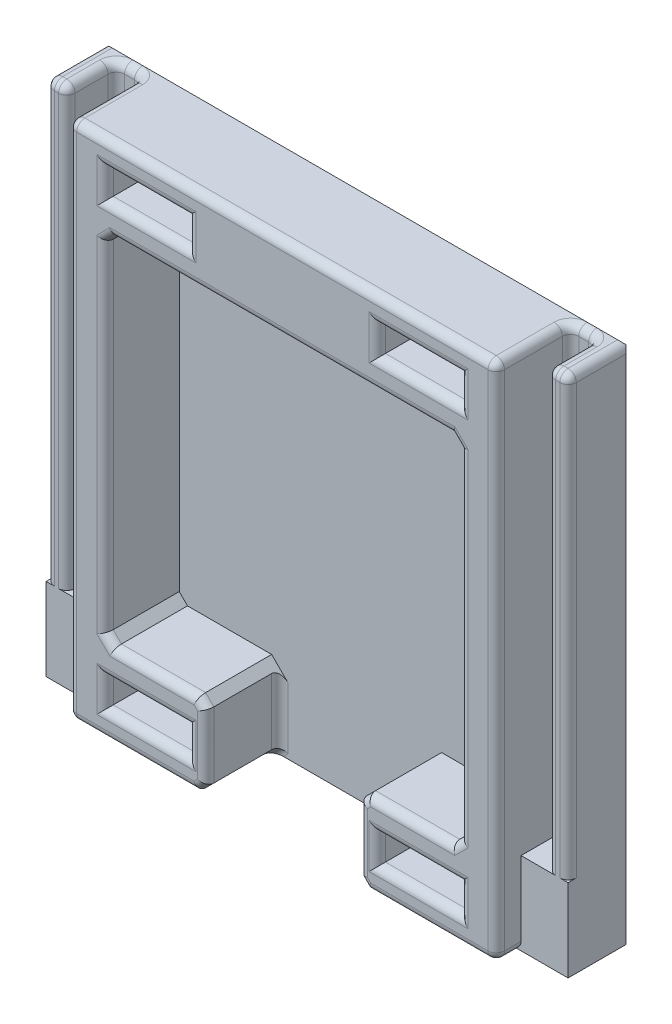
from build123d import *

# Parameters (mm, degrees)
BOSS_EXTRU_2_DEPTH      = 9
ESQUISSE3_W             = 51.8612703
ESQUISSE3_H             = 63
BOSS_EXTRU_3_DEPTH      = 3
ESQUISSE4_W             = 10
ESQUISSE4_H             = 3.4
ENL_V_MAT_EXTRU_1_DEPTH = 7
ESQUISSE5_W             = 3.2
ESQUISSE5_H             = 3
BOSS_EXTRU_4_DEPTH      = 63
CHANFREIN1_SIZE         = 1
CHANFREIN2_SIZE         = 2
CONG_1_R                = 1
CONG_2_R                = 1
CHANFREIN4_SIZE         = 1
CONG_4_R                = 1
CONG_5_R                = 1
ESQUISSE6_W             = 6.7
ESQUISSE6_H             = 1
BOSS_EXTRU_5_DEPTH      = 10


with BuildPart() as part:
    # Esquisse2 → Boss.-Extru.2 (new body)
    with BuildSketch(Plane.XY):
        Polygon((-9.3, -31.5), (-9.3, -21.5), (-21.5, -21.5), (-21.5, 21.5), (21.5, 21.5), (21.5, -21.5), (9.3, -21.5), (9.3, -31.5), (25.93063515, -31.5), (25.93063515, 31.5), (-25.93063515, 31.5), (-25.93063515, -31.5), align=None)
    extrude(amount=BOSS_EXTRU_2_DEPTH)

    # Esquisse3 → Boss.-Extru.3 (add)
    with BuildSketch(Plane(origin=(0, 0, 0), x_dir=(-1, 0, 0), z_dir=(0, 0, -1))):
        Rectangle(ESQUISSE3_W, ESQUISSE3_H)
    extrude(amount=BOSS_EXTRU_3_DEPTH)

    # Esquisse4 → Enlèv. mat.-Extru.1 (cut)
    with BuildSketch(Plane.XY.offset(9)):
        with Locations((-16.5, -26.695538472)):
            Rectangle(ESQUISSE4_W, ESQUISSE4_H)
        with Locations((16.5, -26.695538472)):
            Rectangle(ESQUISSE4_W, ESQUISSE4_H)
        with Locations((16.5, 26.695538472)):
            Rectangle(ESQUISSE4_W, ESQUISSE4_H)
        with Locations((-16.5, 26.695538472)):
            Rectangle(ESQUISSE4_W, ESQUISSE4_H)
    extrude(amount=-ENL_V_MAT_EXTRU_1_DEPTH, mode=Mode.SUBTRACT)

    # Esquisse5 → Boss.-Extru.4 (add)
    with BuildSketch(Plane(origin=(0, 31.5, 0), x_dir=(1, 0, 0), z_dir=(0, 1, 0))):
        Polygon((-29.13063515, 0), (-29.13063515, 3), (-31.63063515, 3), (-31.63063515, -6), (-29.13063515, -6), align=None)
        with Locations((-27.53063515, 1.5)):
            Rectangle(ESQUISSE5_W, ESQUISSE5_H)
        with Locations((27.53063515, 1.5)):
            Rectangle(ESQUISSE5_W, ESQUISSE5_H)
        Polygon((29.13063515, 3), (29.13063515, 0), (29.13063515, -6), (31.63063515, -6), (31.63063515, 3), align=None)
    extrude(amount=-BOSS_EXTRU_4_DEPTH)

    # Chanfrein1
    chanfrein1_edges = [part.edges().sort_by_distance(p)[0] for p in [
        (21.5, -21.5, 4.5),
        (21.5, 21.5, 4.5),
        (-21.5, 21.5, 4.5),
        (-21.5, -21.5, 4.5),
    ]]
    chamfer(chanfrein1_edges, length=CHANFREIN1_SIZE)

    # Chanfrein2
    chanfrein2_edges = [part.edges().sort_by_distance(p)[0] for p in [
        (-31.63063515, 0, -3),
        (31.63063515, 0, -3),
        (0, -31.5, -3),
        (0, 31.5, -3),
    ]]
    chamfer(chanfrein2_edges, length=CHANFREIN2_SIZE)

    # Congé1
    cong_1_edges = [part.edges().sort_by_distance(p)[0] for p in [
        (-25.93063515, 0, 0),
        (-29.13063515, 0, 0),
        (-29.13063515, 0, 6),
        (-31.63063515, 0, 6),
        (25.93063515, 0, 0),
        (29.13063515, 0, 0),
        (29.13063515, 0, 6),
        (31.63063515, 0, 6),
    ]]
    fillet(cong_1_edges, radius=CONG_1_R)

    # Congé2
    cong_2_edges = [part.edges().sort_by_distance(p)[0] for p in [
        (-31.63063515, 31.5, 2),
        (31.63063515, 31.5, 2),
        (30.38063515, -31.5, 6),
        (30.38063515, 31.5, 6),
        (-30.38063515, 31.5, 6),
        (-29.13063515, 31.5, 3),
        (-27.53063515, 31.5, 0),
        (27.53063515, 31.5, 0),
        (29.13063515, 31.5, 3),
        (-31.337741931, 31.5, 5.707106781),
        (-29.423528369, 31.5, 5.707106781),
        (29.423528369, 31.5, 5.707106781),
        (31.337741931, 31.5, 5.707106781),
        (31.63063515, -31.5, 2),
        (-31.63063515, -31.5, 2),
        (29.13063515, -31.5, 3),
        (27.53063515, -31.5, 0),
        (-27.53063515, -31.5, 0),
        (-29.13063515, -31.5, 3),
        (-30.38063515, -31.5, 6),
        (-31.337741931, -31.5, 5.707106781),
        (-29.423528369, -31.5, 5.707106781),
        (29.423528369, -31.5, 5.707106781),
        (31.337741931, -31.5, 5.707106781),
        (28.837741931, 31.5, 0.292893219),
        (28.837741931, -31.5, 0.292893219),
        (26.223528369, 31.5, 0.292893219),
        (26.223528369, -31.5, 0.292893219),
        (-28.837741931, 31.5, 0.292893219),
        (-28.837741931, -31.5, 0.292893219),
        (-26.223528369, 31.5, 0.292893219),
        (-26.223528369, -31.5, 0.292893219),
        (-25.93063515, -31.5, 5),
        (-25.93063515, 31.5, 5),
        (25.93063515, 31.5, 5),
        (25.93063515, -31.5, 5),
    ]]
    fillet(cong_2_edges, radius=CONG_2_R - 0.0001)  # a hair under: the kernel refuses the full size

    # Chanfrein4
    chanfrein4_edges = [part.edges().sort_by_distance(p)[0] for p in [
        (-9.3, -31.5, 4.5),
        (9.3, -31.5, 4.5),
        (9.3, -21.5, 4.5),
        (-9.3, -21.5, 4.5),
    ]]
    chamfer(chanfrein4_edges, length=CHANFREIN4_SIZE)

    # Congé4
    cong_4_edges = [part.edges().sort_by_distance(p)[0] for p in [
        (-21.5, 0, 9),
        (-15.4, -21.5, 9),
        (21.5, 0, 9),
        (0, 21.5, 9),
        (-21, -21, 9),
        (21, -21, 9),
        (21, 21, 9),
        (-21, 21, 9),
        (0, 31.5, 9),
        (-17.615367575, -31.5, 9),
        (-25.93063515, 0, 9),
        (25.93063515, 0, 9),
        (25.63777122, 31.207136071, 9),
        (25.63777122, -31.207136071, 9),
        (-25.63777122, -31.207136071, 9),
        (-25.63777122, 31.207136071, 9),
        (17.615367575, -31.5, 9),
        (9.3, -26.5, 9),
        (-9.3, -26.5, 9),
        (15.4, -21.5, 9),
        (-9.8, -22, 9),
        (9.8, -22, 9),
        (-9.8, -31, 9),
        (9.8, -31, 9),
        (-16.5, 28.395538472, 9),
        (-11.5, 26.695538472, 9),
        (-21.5, 26.695538472, 9),
        (-16.5, 24.995538472, 9),
        (21.5, 26.695538472, 9),
        (16.5, 24.995538472, 9),
        (16.5, 28.395538472, 9),
        (11.5, 26.695538472, 9),
        (16.5, -28.395538472, 9),
        (11.5, -26.695538472, 9),
        (21.5, -26.695538472, 9),
        (16.5, -24.995538472, 9),
        (-21.5, -26.695538472, 9),
        (-16.5, -24.995538472, 9),
        (-16.5, -28.395538472, 9),
        (-11.5, -26.695538472, 9),
    ]]
    fillet(cong_4_edges, radius=CONG_4_R - 0.0001)  # a hair under: the kernel refuses the full size

    # Congé5
    cong_5_edges = [part.edges().sort_by_distance(p)[0] for p in [
        (9.3, -26.5, 0),
        (-9.3, -26.5, 0),
        (9.8, -31, 0),
        (-9.8, -31, 0),
    ]]
    fillet(cong_5_edges, radius=CONG_5_R)

    # Esquisse6 → Boss.-Extru.5 (add)
    with BuildSketch(Plane.XZ.offset(31.5)):
        with BuildLine():
            Line((-24.93063515, 1), (-24.93063515, 5))
            Line((-24.93063515, 5), (-31.63063515, 5))
            Line((-31.63063515, 5), (-31.63063515, -1))
            Line((-31.63063515, -1), (-26.93063515, -1))
            ThreePointArc((-26.93063515, -1), (-25.516421587, -0.414213562), (-24.93063515, 1))
        make_face()
        with Locations((-28.28063515, 5.5)):
            Rectangle(ESQUISSE6_W, ESQUISSE6_H)
        with BuildLine():
            Line((31.63063515, -1), (31.63063515, 5))
            Line((31.63063515, 5), (24.93063515, 5))
            Line((24.93063515, 5), (24.93063515, 1))
            ThreePointArc((24.93063515, 1), (25.516421587, -0.414213562), (26.93063515, -1))
            Line((26.93063515, -1), (31.63063515, -1))
        make_face()
        with Locations((28.28063515, 5.5)):
            Rectangle(ESQUISSE6_W, ESQUISSE6_H)
    extrude(amount=-BOSS_EXTRU_5_DEPTH)


solid = part.part
